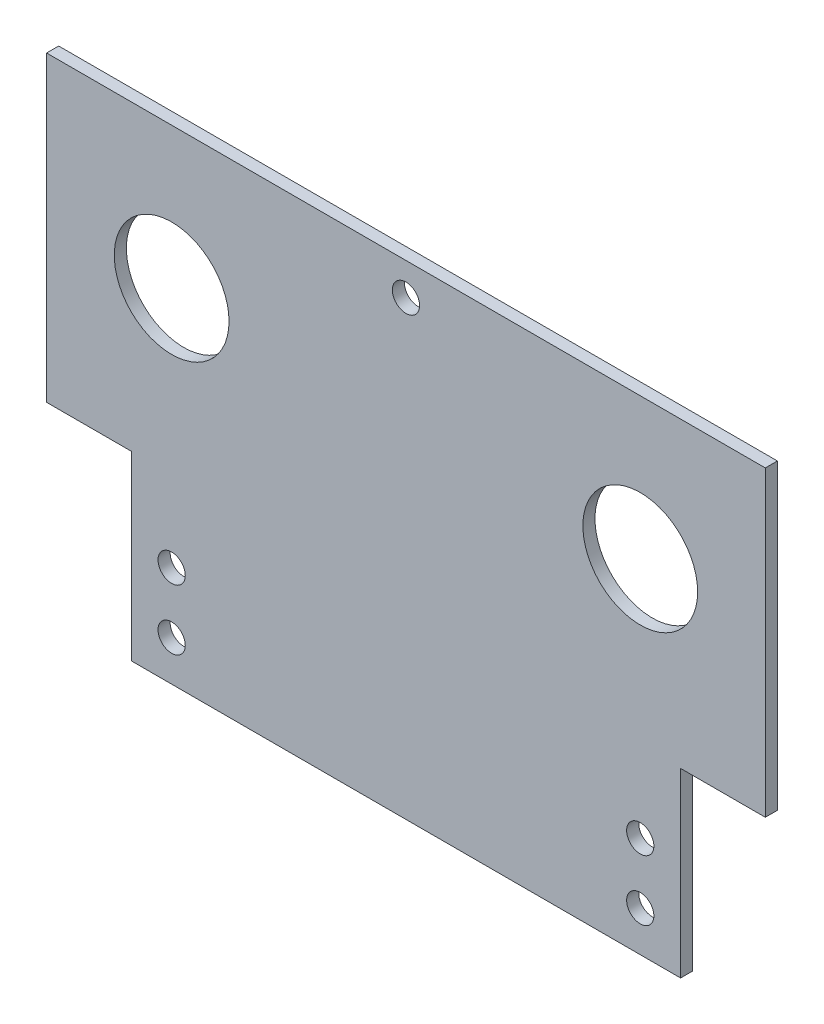
from build123d import *

# Parameters (mm, degrees)
SKETCH1_W           = 178.16
SKETCH1_H           = 120
BOSS_EXTRUDE1_DEPTH = 3
SKETCH2_R           = 14.225
SKETCH2_R_2         = 3.375
CUT_EXTRUDE1_DEPTH  = 215.825477074
SKETCH3_W           = 21
SKETCH3_H           = 45
CUT_EXTRUDE2_DEPTH  = 215.825477074


with BuildPart() as part:
    # Sketch1 → Boss-Extrude1 (new body)
    with BuildSketch(Plane.XY):
        with Locations((89.08, -60)):
            Rectangle(SKETCH1_W, SKETCH1_H)
    extrude(amount=BOSS_EXTRUDE1_DEPTH)

    # Sketch2 → Cut-Extrude1 (cut, through all)
    with BuildSketch(Plane.XY.offset(3)):
        with Locations((31, -35)):
            Circle(SKETCH2_R)
        with Locations((147.16, -35)):
            Circle(SKETCH2_R)
        with Locations((31, -110)):
            Circle(SKETCH2_R_2)
        with Locations((147.16, -110)):
            Circle(SKETCH2_R_2)
        with Locations((89.08, -8)):
            Circle(SKETCH2_R_2)
        with Locations((31, -95)):
            Circle(SKETCH2_R_2)
        with Locations((147.16, -95)):
            Circle(SKETCH2_R_2)
    extrude(amount=-CUT_EXTRUDE1_DEPTH, mode=Mode.SUBTRACT)

    # Sketch3 → Cut-Extrude2 (cut, through all)
    with BuildSketch(Plane(origin=(0, 0, 0), x_dir=(-1, 0, 0), z_dir=(0, 0, -1))):
        with Locations((-10.5, -97.5)):
            Rectangle(SKETCH3_W, SKETCH3_H)
        with Locations((-167.66, -97.5)):
            Rectangle(SKETCH3_W, SKETCH3_H)
    extrude(amount=-CUT_EXTRUDE2_DEPTH, mode=Mode.SUBTRACT)


solid = part.part
